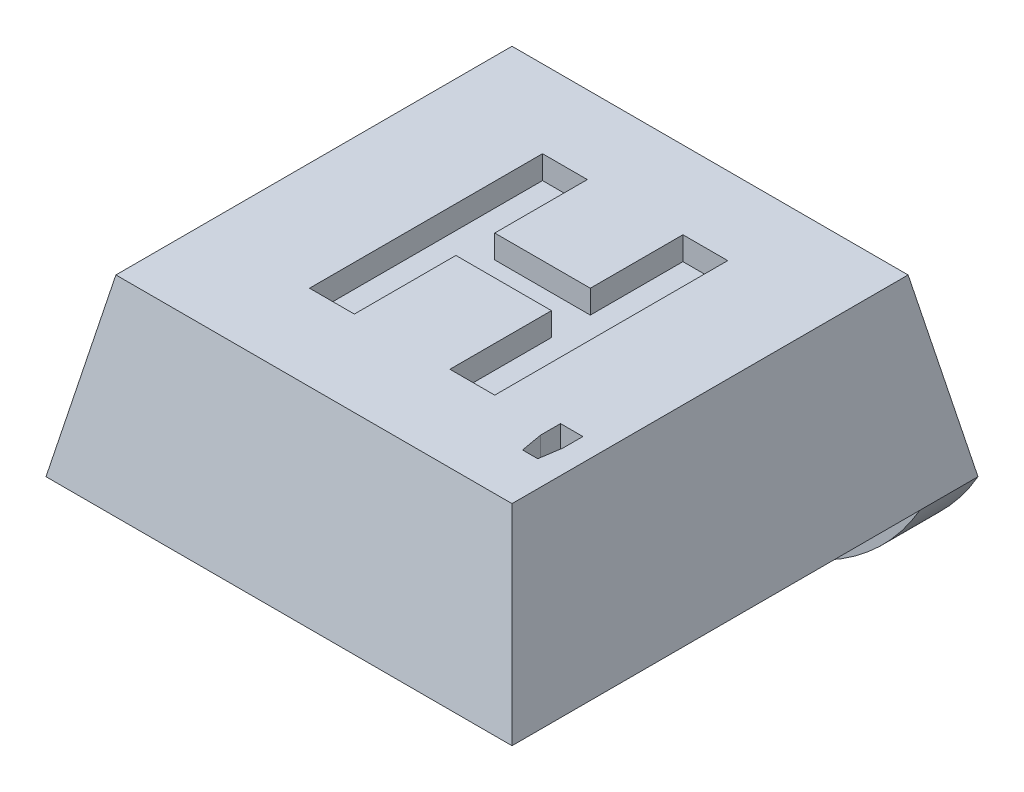
from build123d import *

# Parameters (mm, degrees)
SKETCH1_W               = 8
SKETCH1_H               = 8
BOSS_EXTRUDE1_DEPTH     = 3
CUT_EXTRUDE1_DEPTH      = 12.704699911
CUT_EXTRUDE1_DEPTH_BACK = 12.704699911
CUT_EXTRUDE2_DEPTH      = 11
SKETCH4_R               = 1.8
CUT_EXTRUDE3_DEPTH      = 0.8
SKETCH5_W               = 8
SKETCH5_H               = 1
BOSS_EXTRUDE2_DEPTH     = 2
FILLET1_R               = 4
CUT_EXTRUDE4_DEPTH      = 0.4
CUT_EXTRUDE5_DEPTH      = 0.4


with BuildPart() as part:
    # Sketch1 → Boss-Extrude1 (new body)
    with BuildSketch(Plane(origin=(0, 0, 0), x_dir=(1, 0, 0), z_dir=(0, 1, 0))):
        with Locations((4, 4)):
            Rectangle(SKETCH1_W, SKETCH1_H)
    extrude(amount=BOSS_EXTRUDE1_DEPTH)

    # Sketch2 → Cut-Extrude1 (cut, two sides: drawn at the far end of the back side and taken through both)
    with BuildSketch(Plane.XY.offset(-CUT_EXTRUDE1_DEPTH_BACK)):
        Polygon((0, 0), (0.6, 3), (0, 3), align=None)
        Polygon((8, 0), (7.4, 3), (8, 3), align=None)
    extrude(amount=CUT_EXTRUDE1_DEPTH + CUT_EXTRUDE1_DEPTH_BACK, mode=Mode.SUBTRACT)

    # Sketch3 → Cut-Extrude2 (cut)
    with BuildSketch(Plane(origin=(0, 0, 0), x_dir=(0, 0, -1), z_dir=(1, 0, 0))):
        Polygon((0, 0), (0.6, 3), (0, 3), align=None)
        Polygon((8, 3), (7.4, 3), (8, 0), align=None)
    extrude(amount=CUT_EXTRUDE2_DEPTH, mode=Mode.SUBTRACT)

    # Sketch4 → Cut-Extrude3 (cut)
    with BuildSketch(Plane.XZ):
        with Locations(Location((4, -3.75, 0), (0, 0, 270))):
            Circle(SKETCH4_R)
    extrude(amount=-CUT_EXTRUDE3_DEPTH, mode=Mode.SUBTRACT)

    # Sketch5 → Boss-Extrude2 (add)
    with BuildSketch(Plane.XZ):
        with Locations((4, -7.5)):
            Rectangle(SKETCH5_W, SKETCH5_H)
    extrude(amount=BOSS_EXTRUDE2_DEPTH)

    # Fillet1
    # the kernel refuses this fillet: 4 mm, written as the material it takes off along each edge
    with BuildSketch(Plane(origin=(8, -2, -16.660254038), x_dir=(0, 1, 0), z_dir=(0, 0, 1)), Plane(origin=(0, -2, 1.660254038), x_dir=(0, 1, 0), z_dir=(0, 0, -1))) as fillet1_piece_1:
        with BuildLine():
            CenterArc((4, 3.464101615), FILLET1_R, 180, 60)
            Line((0, 3.464101615), (-0.08, 3.464101615))
            Line((-0.08, 3.464101615), (-0.08, 0))
            Line((-0.08, 0), (0, -0.08))
            ThreePointArc((0, -0.08), (1, -0.08), (1.96, -0.069282032))
            Line((1.96, -0.069282032), (2, 0))
        make_face()
    extrude(amount=18.320508076, mode=Mode.SUBTRACT)

    # Sketch6 → Cut-Extrude4 (cut)
    with BuildSketch(Plane(origin=(0, 3, 0), x_dir=(1, 0, 0), z_dir=(0, 1, 0))):
        Polygon((2.459405501, 2.064543337), (2.459405501, 6.064543337), (3.22863627, 6.064543337), (3.22863627, 4.474799747), (4.869661911, 4.474799747), (4.869661911, 6.064543337), (5.63889268, 6.064543337), (5.63889268, 2.064543337), (4.869661911, 2.064543337), (4.869661911, 3.80813308), (3.22863627, 3.80813308), (3.22863627, 2.064543337), align=None)
    extrude(amount=-CUT_EXTRUDE4_DEPTH, mode=Mode.SUBTRACT)

    # Sketch7 → Cut-Extrude5 (cut)
    with BuildSketch(Plane(origin=(0, 3, 0), x_dir=(1, 0, 0), z_dir=(0, 1, 0))):
        Polygon((6.693034442, 1.488274187), (6.626528032, 1.86447611), (6.626528032, 2.206222905), (7.011143417, 2.206222905), (7.011143417, 1.86447611), (6.953451109, 1.488274187), align=None)
    extrude(amount=-CUT_EXTRUDE5_DEPTH, mode=Mode.SUBTRACT)


solid = part.part
